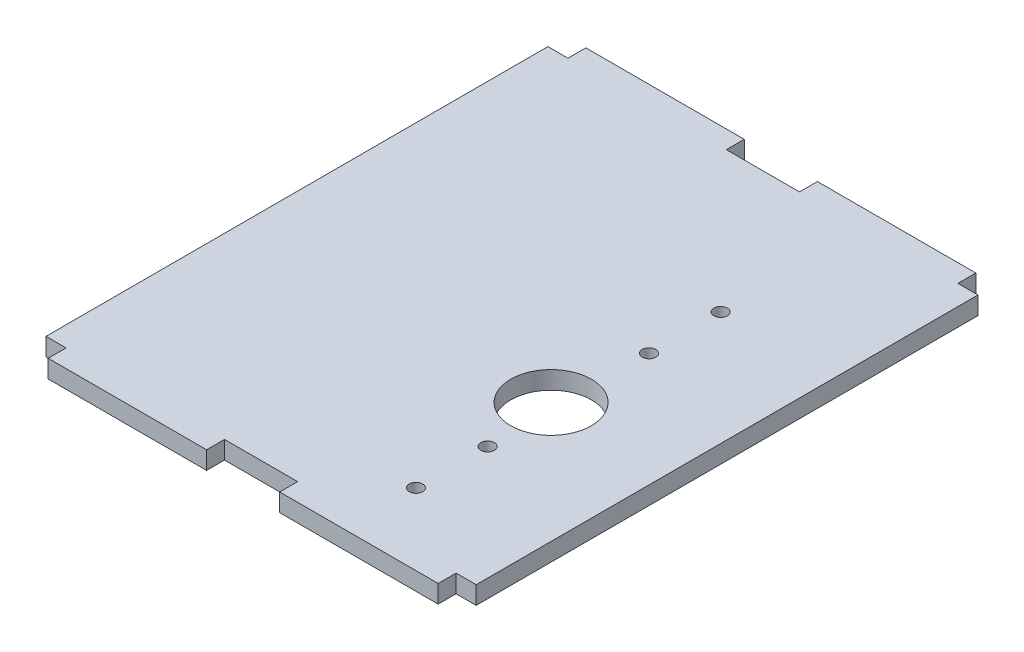
from build123d import *

# Parameters (mm, degrees)
SKETCH1_W           = 304.8
SKETCH1_H           = 355.6
SKETCH1_RX          = 28.575
SKETCH1_RY          = 28.573991153
BOSS_EXTRUDE1_DEPTH = 12.7
SKETCH2_R           = 4.7625
CUT_EXTRUDE1_DEPTH  = 12.7
SKETCH3_W           = 112.268
SKETCH3_H           = 12.7
BOSS_EXTRUDE2_DEPTH = 12.7


with BuildPart() as part:
    # Sketch1 → Boss-Extrude1 (new body)
    with BuildSketch(Plane(origin=(0, 0, 0), x_dir=(1, 0, 0), z_dir=(0, 1, 0))):
        with Locations((152.4, 177.8)):
            Rectangle(SKETCH1_W, SKETCH1_H)
        with Locations(Location((219.512197498, 138.386094447), (0, 0, 0))):
            Ellipse(SKETCH1_RX, SKETCH1_RY, mode=Mode.SUBTRACT)
    extrude(amount=BOSS_EXTRUDE1_DEPTH)

    # Sketch2 → Cut-Extrude1 (cut)
    with BuildSketch(Plane.XZ):
        with Locations((224.028, -38.1)):
            Circle(SKETCH2_R)
        with Locations((224.028, -88.9)):
            Circle(SKETCH2_R)
        with Locations((224.028, -203.2)):
            Circle(SKETCH2_R)
        with Locations((224.028, -254)):
            Circle(SKETCH2_R)
    extrude(amount=-CUT_EXTRUDE1_DEPTH, mode=Mode.SUBTRACT)

    # Sketch3 → Boss-Extrude2 (add)
    with BuildSketch(Plane(origin=(0, 12.7, 0), x_dir=(1, 0, 0), z_dir=(0, 1, 0))):
        with Locations((70.358, 361.95)):
            Rectangle(SKETCH3_W, SKETCH3_H)
        with Locations((234.442, 361.95)):
            Rectangle(SKETCH3_W, SKETCH3_H)
        with Locations((234.442, -6.35)):
            Rectangle(SKETCH3_W, SKETCH3_H)
        with Locations((70.358, -6.35)):
            Rectangle(SKETCH3_W, SKETCH3_H)
    extrude(amount=-BOSS_EXTRUDE2_DEPTH)


solid = part.part
